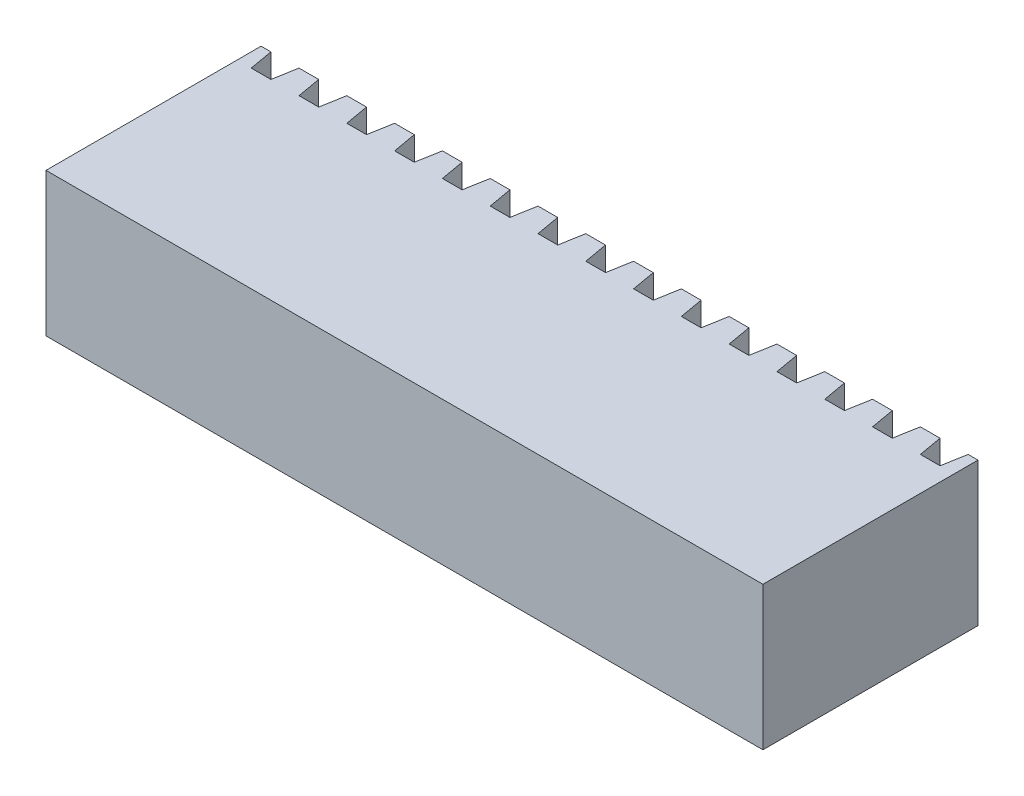
from build123d import *

# Parameters (mm, degrees)
SKETCH1_W            = 30
SKETCH1_H            = 9
BOSS_EXTRUDE1_DEPTH  = 6
CUT_EXTRUDE1_DEPTH   = 32.890437438
LPATTERN2_COUNT      = 8
LPATTERN2_PITCH      = 2
LPATTERN2_COUNT_DIR2 = 8
LPATTERN2_PITCH_DIR2 = 2


with BuildPart() as part:
    # Sketch1 → Boss-Extrude1 (new body)
    with BuildSketch(Plane(origin=(0, 0, 0), x_dir=(1, 0, 0), z_dir=(0, 1, 0))):
        with Locations((15, 4.5)):
            Rectangle(SKETCH1_W, SKETCH1_H)
    extrude(amount=BOSS_EXTRUDE1_DEPTH)

    # Sketch2 → Cut-Extrude1 (cut, through all)
    with BuildSketch(Plane(origin=(0, 6, 0), x_dir=(1, 0, 0), z_dir=(0, 1, 0))):
        Polygon((14.41183651, 9), (15.58816349, 9), (15.41183651, 8), (14.58816349, 8), align=None)
    cut_extrude1 = extrude(amount=-CUT_EXTRUDE1_DEPTH, mode=Mode.SUBTRACT)

    # LPattern2: Cut-Extrude1 8 × 8
    with Locations(*[Vector(-1, 0, 0) * (i * LPATTERN2_PITCH) + Vector(1, 0, 0) * (j * LPATTERN2_PITCH_DIR2) for i in range(LPATTERN2_COUNT) for j in range(LPATTERN2_COUNT_DIR2) if (i, j) != (0, 0)]):
        add(cut_extrude1, mode=Mode.SUBTRACT)


solid = part.part
